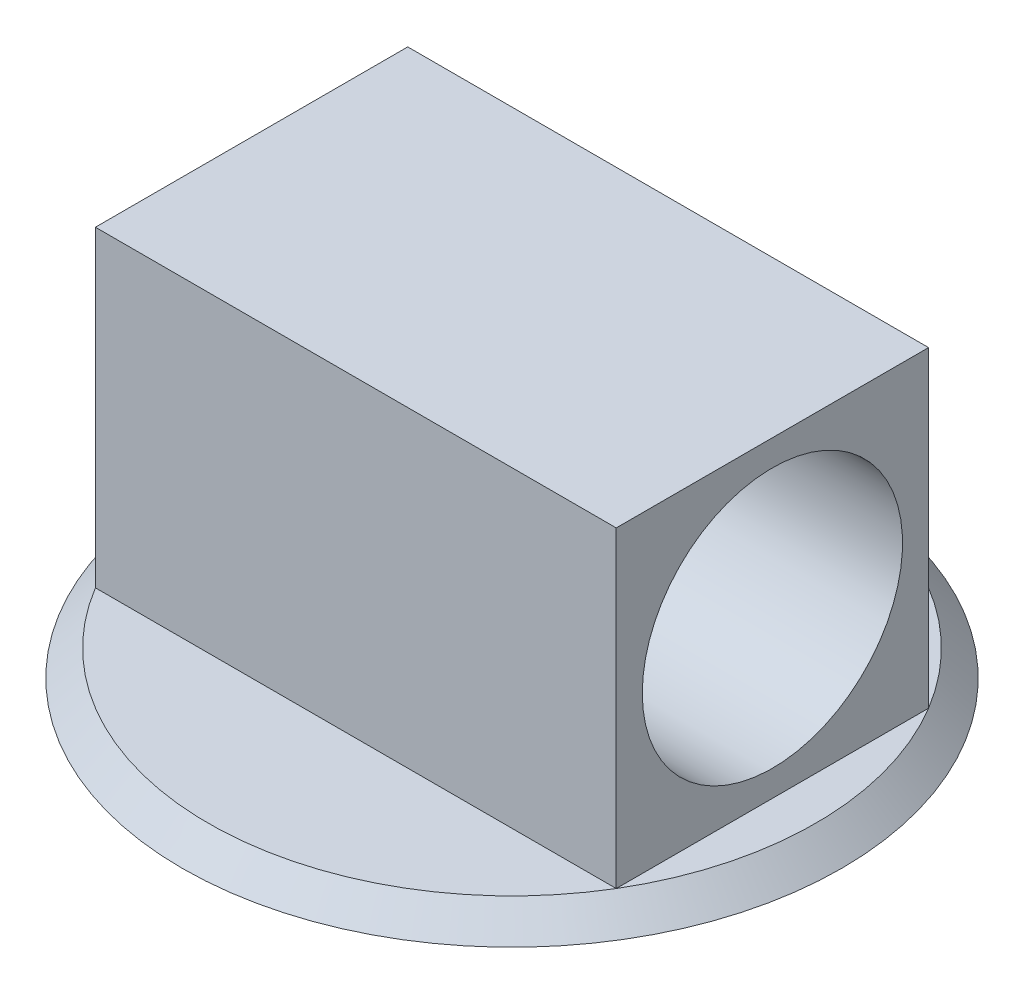
from build123d import *

# Parameters (mm, degrees)
SKETCH13_R              = 20
BOSS_EXTRUDE2_DEPTH     = 1.5
CHAMFER1_SIZE           = 2.5
ESQUISSE1_W             = 30.01666204
ESQUISSE1_H             = 18
BOSS_EXTRU_1_DEPTH      = 18
ESQUISSE2_R             = 7.5
ENL_V_MAT_EXTRU_1_DEPTH = 40


with BuildPart() as part:
    # Sketch13 → Boss-Extrude2 (new body)
    with BuildSketch(Plane(origin=(0, 0, 0), x_dir=(1, 0, 0), z_dir=(0, 1, 0))):
        with Locations(Location((0, 8, 0), (0, 0, 270))):
            Circle(SKETCH13_R)
    extrude(amount=BOSS_EXTRUDE2_DEPTH)

    # Chamfer1
    # the kernel refuses this chamfer: 2.5 mm, written as the material it takes off along each edge
    with BuildSketch(Plane(origin=(0, 1.5, -8), x_dir=(0, 0, 1), z_dir=(-1, 0, 0))) as chamfer1_piece_1:
        Polygon((20, -CHAMFER1_SIZE), (20 - CHAMFER1_SIZE, 0), (20, 0), align=None)
    revolve(axis=Axis((0, 1.5, -8), (0, 1, 0)), mode=Mode.SUBTRACT)

    # Esquisse1 → Boss.-Extru.1 (add)
    with BuildSketch(Plane(origin=(0, 1.5, 0), x_dir=(1, 0, 0), z_dir=(0, 1, 0))):
        with Locations((0, 8)):
            Rectangle(ESQUISSE1_W, ESQUISSE1_H)
    extrude(amount=BOSS_EXTRU_1_DEPTH)

    # Esquisse2 → Enlèv. mat.-Extru.1 (cut)
    with BuildSketch(Plane.ZY.offset(15.00833102)):
        with Locations((-8, 10.5)):
            Circle(ESQUISSE2_R)
    extrude(amount=-ENL_V_MAT_EXTRU_1_DEPTH, mode=Mode.SUBTRACT)


solid = part.part
